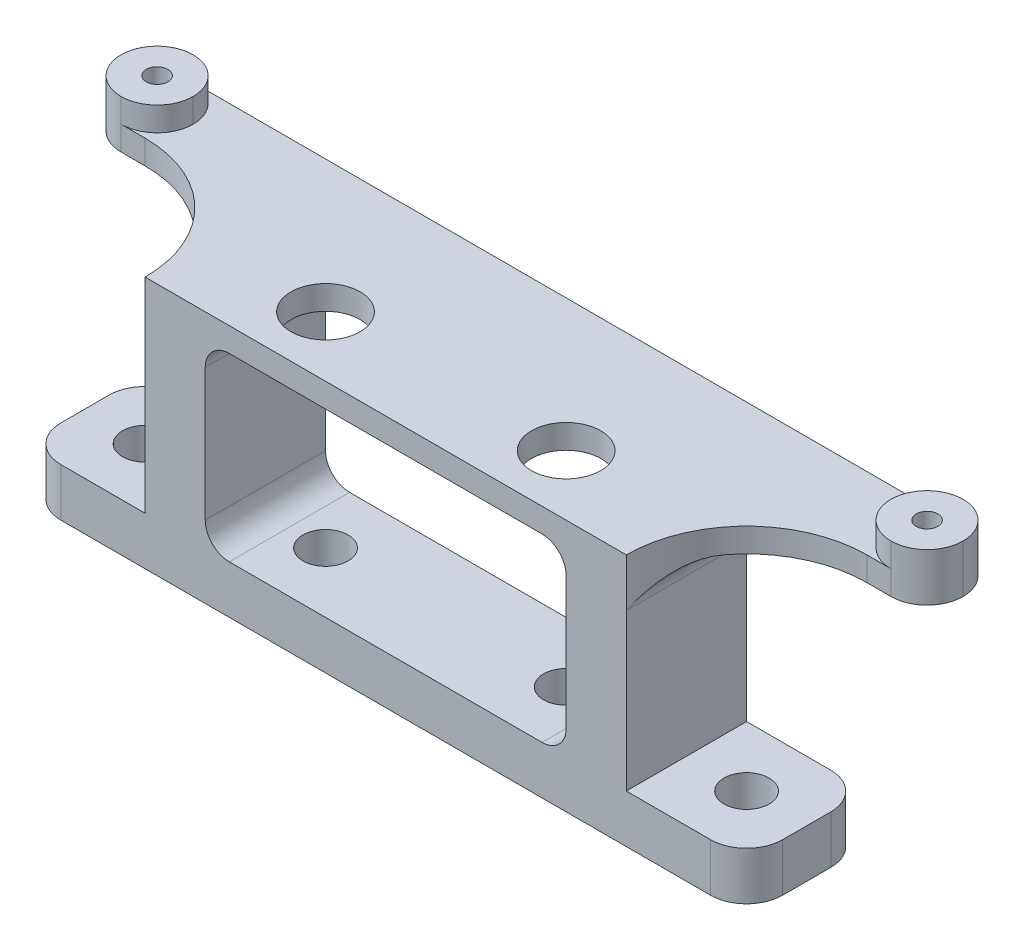
from build123d import *

# Parameters (mm, degrees)
SKETCH1_W           = 60
SKETCH1_H           = 10
BOSS_EXTRUDE1_DEPTH = 4
SKETCH2_R           = 1.875
CUT_EXTRUDE1_DEPTH  = 31.6757233
SKETCH4_W           = 5
SKETCH4_H           = 10
BOSS_EXTRUDE2_DEPTH = 15
BOSS_EXTRUDE3_DEPTH = 4
SKETCH7_W           = 58
SKETCH7_H           = 6
CUT_EXTRUDE2_DEPTH  = 2
SKETCH9_W           = 40
SKETCH9_H           = 10
CUT_EXTRUDE3_DEPTH  = 2
CUT_EXTRUDE5_REACH  = 44.273
SKETCH10_R          = 2.875
FILLET1_R           = 10
FILLET2_R           = 3
FILLET3_R           = 2
SKETCH8_R           = 0.9
CUT_EXTRUDE4_DEPTH  = 44.301270189
FILLET4_R           = 2


# Some blends are built 0.0001 mm under size
with BuildPart() as part:
    # Sketch1 → Boss-Extrude1 (new body)
    with BuildSketch(Plane(origin=(0, 0, 0), x_dir=(1, 0, 0), z_dir=(0, 1, 0))):
        Rectangle(SKETCH1_W, SKETCH1_H)
    extrude(amount=BOSS_EXTRUDE1_DEPTH)

    # Sketch2 → Cut-Extrude1 (cut, through all)
    with BuildSketch(Plane(origin=(0, 4, 0), x_dir=(1, 0, 0), z_dir=(0, 1, 0))):
        with Locations(Location((-25, 0, 0), (0, 0, 270))):
            Circle(SKETCH2_R)
        with Locations(Location((-10, 0, 0), (0, 0, 270))):
            Circle(SKETCH2_R)
        with Locations(Location((10, 0, 0), (0, 0, 270))):
            Circle(SKETCH2_R)
        with Locations(Location((25, 0, 0), (0, 0, 270))):
            Circle(SKETCH2_R)
    extrude(amount=-CUT_EXTRUDE1_DEPTH, mode=Mode.SUBTRACT)

    # Sketch4 → Boss-Extrude2 (add)
    with BuildSketch(Plane(origin=(0, 4, 0), x_dir=(1, 0, 0), z_dir=(0, 1, 0))):
        with Locations((-17.5, 0)):
            Rectangle(SKETCH4_W, SKETCH4_H)
        with Locations((17.5, 0)):
            Rectangle(SKETCH4_W, SKETCH4_H)
    extrude(amount=BOSS_EXTRUDE2_DEPTH)

    # Sketch5 → Boss-Extrude3 (add)
    with BuildSketch(Plane(origin=(0, 19, 0), x_dir=(1, 0, 0), z_dir=(0, 1, 0))):
        Polygon((-20, -5), (20, -5), (20, 5), (35, 5), (35, 11), (-35, 11), (-35, 5), (-20, 5), align=None)
    extrude(amount=BOSS_EXTRUDE3_DEPTH)

    # Sketch7 → Cut-Extrude2 (cut)
    with BuildSketch(Plane(origin=(0, 23, 0), x_dir=(1, 0, 0), z_dir=(0, 1, 0))):
        with Locations((0, 8)):
            Rectangle(SKETCH7_W, SKETCH7_H)
    extrude(amount=-CUT_EXTRUDE2_DEPTH, mode=Mode.SUBTRACT)

    # Sketch9 → Cut-Extrude3 (cut)
    with BuildSketch(Plane(origin=(0, 23, 0), x_dir=(1, 0, 0), z_dir=(0, 1, 0))):
        Rectangle(SKETCH9_W, SKETCH9_H)
    extrude(amount=-CUT_EXTRUDE3_DEPTH, mode=Mode.SUBTRACT)

    # Sketch10 → Cut-Extrude5 (cut, up to next)
    with BuildSketch(Plane(origin=(0, 21, 0), x_dir=(1, 0, 0), z_dir=(0, 1, 0)), mode=Mode.PRIVATE) as cut_extrude5_sk1:
        with Locations(Location((-10, 0, 0), (0, 0, 270))):
            Circle(SKETCH10_R)
    cut_extrude5_tool1 = extrude(cut_extrude5_sk1.sketch, amount=-CUT_EXTRUDE5_REACH, mode=Mode.PRIVATE) & part.part
    # Sketch10 → Cut-Extrude5 (cut, up to next)
    with BuildSketch(Plane(origin=(0, 21, 0), x_dir=(1, 0, 0), z_dir=(0, 1, 0)), mode=Mode.PRIVATE) as cut_extrude5_sk2:
        with Locations(Location((10, 0, 0), (0, 0, 270))):
            Circle(SKETCH10_R)
    cut_extrude5_tool2 = extrude(cut_extrude5_sk2.sketch, amount=-CUT_EXTRUDE5_REACH, mode=Mode.PRIVATE) & part.part
    add(cut_extrude5_tool1.solids().sort_by_distance((-10, 21, 0))[0], mode=Mode.SUBTRACT)
    add(cut_extrude5_tool2.solids().sort_by_distance((10, 21, 0))[0], mode=Mode.SUBTRACT)

    # Fillet1
    fillet1_edges = [part.edges().sort_by_distance(p)[0] for p in [
        (20, 20, -5),
        (-20, 20, -5),
    ]]
    fillet(fillet1_edges, radius=FILLET1_R - 0.0001)  # a hair under: the kernel refuses the full size

    # Fillet2
    # the kernel refuses this fillet: 3 mm, written as the material it takes off along each edge
    with BuildSketch(Plane(origin=(30, -7.5, -5), x_dir=(-1, 0, 0), z_dir=(0, 1, 0)), Plane(origin=(-30, -7.5, 5), x_dir=(1, 0, 0), z_dir=(0, 1, 0)), Plane(origin=(-35, 11.5, -5), x_dir=(1, 0, 0), z_dir=(0, 1, 0)), Plane(origin=(35, 11.5, -11), x_dir=(-1, 0, 0), z_dir=(0, 1, 0))) as fillet2_piece_1:
        with BuildLine():
            CenterArc((FILLET2_R, FILLET2_R), FILLET2_R, 180, 90)
            Line((0, FILLET2_R), (0, 0))
            Line((0, 0), (FILLET2_R, 0))
        make_face()
    fillet2_piece_1_solid = extrude(amount=19, mode=Mode.PRIVATE)
    with BuildSketch(Plane(origin=(30, -7.5, 5), x_dir=(-1, 0, 0), z_dir=(0, 1, 0)), Plane(origin=(-30, -7.5, -5), x_dir=(1, 0, 0), z_dir=(0, 1, 0)), Plane(origin=(-35, 11.5, -11), x_dir=(1, 0, 0), z_dir=(0, 1, 0)), Plane(origin=(35, 11.5, -5), x_dir=(-1, 0, 0), z_dir=(0, 1, 0))) as fillet2_piece_2:
        with BuildLine():
            CenterArc((FILLET2_R, -FILLET2_R), FILLET2_R, 90, 90)
            Line((0, -FILLET2_R), (0, 0))
            Line((0, 0), (FILLET2_R, 0))
        make_face()
    fillet2_piece_2_solid = extrude(amount=19, mode=Mode.PRIVATE)
    with BuildSketch(Plane(origin=(-29, 30.5, -11), x_dir=(0, 0, 1), z_dir=(0, -1, 0)), Plane(origin=(29, 30.5, -11), x_dir=(1, 0, 0), z_dir=(0, -1, 0))) as fillet2_piece_3:
        with BuildLine():
            CenterArc((FILLET2_R, FILLET2_R), FILLET2_R, 180, 90)
            Line((0, FILLET2_R), (0, 0))
            Line((0, 0), (FILLET2_R, 0))
        make_face()
    fillet2_piece_3_solid = extrude(amount=9.5, mode=Mode.PRIVATE)
    with BuildSketch(Plane(origin=(-29, 21, -4.949883917), x_dir=(-0.9998604946563736, 0, -0.016703030428994153), z_dir=(0, 1, 0))) as fillet2_piece_4:
        with BuildLine():
            CenterArc((3.050527666, -2.999581484), FILLET2_R, 90.957057654, 90)
            Line((0.050946182, -3.049690575), (-0.249011967, -3.054701484))
            Line((-0.249011967, -3.054701484), (-0.299958148, -0.005010909))
            Line((-0.299958148, -0.005010909), (0.025007319, 0.298955906))
            ThreePointArc((0.025007319, 0.298955906), (0.99558669, 0.266550417), (2.995407665, 0.299958148))
            Line((2.995407665, 0.299958148), (3.000418574, 0))
        make_face()
    fillet2_piece_4_solid = extrude(amount=9.625290207, mode=Mode.PRIVATE)
    with BuildSketch(Plane(origin=(29, 21, -4.949883917), x_dir=(0.9998604946563736, 0, -0.01670303042899439), z_dir=(0, 1, 0))) as fillet2_piece_5:
        with BuildLine():
            CenterArc((3.050527666, 2.999581484), FILLET2_R, 179.042942346, 90)
            Line((0.050946182, 3.049690575), (-0.249011967, 3.054701484))
            Line((-0.249011967, 3.054701484), (-0.299958148, 0.005010909))
            Line((-0.299958148, 0.005010909), (0.025007319, -0.298955906))
            ThreePointArc((0.025007319, -0.298955906), (0.99558669, -0.266550417), (2.995407665, -0.299958148))
            Line((2.995407665, -0.299958148), (3.000418574, 0))
        make_face()
    fillet2_piece_5_solid = extrude(amount=9.625290207, mode=Mode.PRIVATE)
    add([fillet2_piece_1_solid, fillet2_piece_2_solid, fillet2_piece_3_solid, fillet2_piece_4_solid, fillet2_piece_5_solid], mode=Mode.SUBTRACT)

    # Fillet3
    fillet3_edges = [part.edges().sort_by_distance(p)[0] for p in [
        (-15, 4, 0),
        (-15, 19, 0),
        (15, 4, 0),
        (15, 19, 0),
    ]]
    fillet(fillet3_edges, radius=FILLET3_R)

    # Sketch8 → Cut-Extrude4 (cut, through all)
    with BuildSketch(Plane(origin=(0, 23, 0), x_dir=(1, 0, 0), z_dir=(0, 1, 0))):
        with Locations(Location((32, 8, 0), (0, 0, 270))):
            Circle(SKETCH8_R)
        with Locations(Location((-32, 8, 0), (0, 0, 270))):
            Circle(SKETCH8_R)
    extrude(amount=-CUT_EXTRUDE4_DEPTH, mode=Mode.SUBTRACT)

    # Fillet4
    fillet4_edges = [part.edges().sort_by_distance(p)[0] for p in [
        (-16.5, 19, -5),
        (16.5, 19, -5),
        (-20, 19, -5e-05),
        (20, 19, -5e-05),
    ]]
    fillet(fillet4_edges, radius=FILLET4_R - 0.0001)  # a hair under: the kernel refuses the full size


solid = part.part
